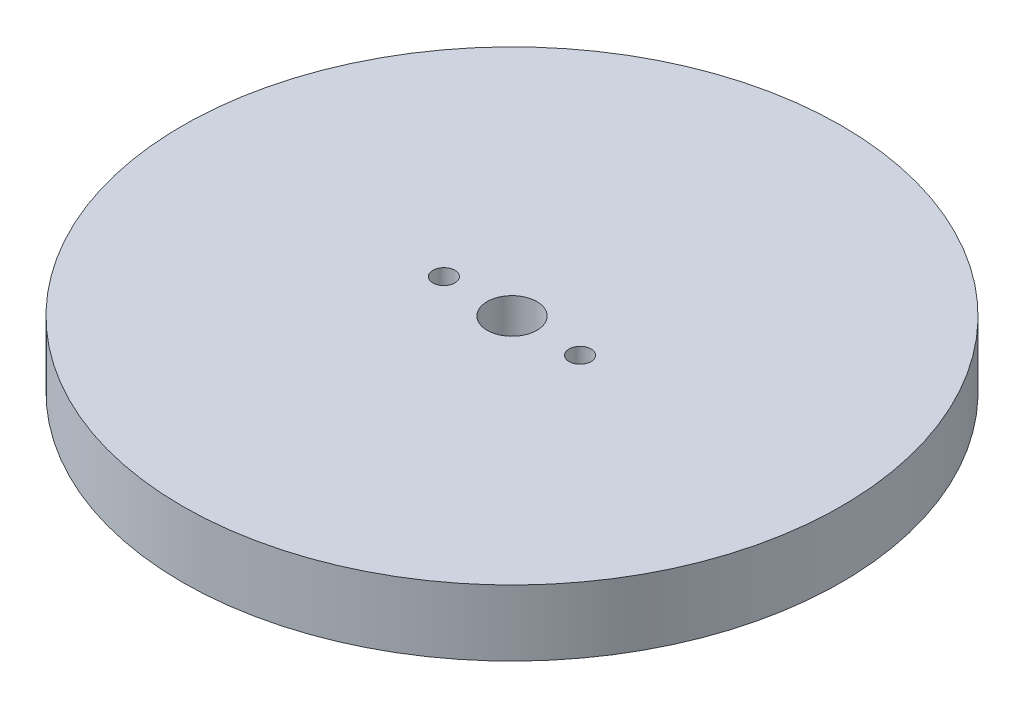
from build123d import *

# Parameters (mm, degrees)
SKETCH1_R           = 45
SKETCH1_R_2         = 3.4
SKETCH1_R_3         = 1.5
BOSS_EXTRUDE1_DEPTH = 9


with BuildPart() as part:
    # Sketch1 → Boss-Extrude1 (new body)
    with BuildSketch(Plane(origin=(0, 0, 0), x_dir=(1, 0, 0), z_dir=(0, 1, 0))):
        with Locations((-30.18350584, -19.145341983)):
            Circle(SKETCH1_R)
        with Locations((-30.18350584, -19.145341983)):
            Circle(SKETCH1_R_2, mode=Mode.SUBTRACT)
        with Locations((-39.48350584, -19.145341983)):
            Circle(SKETCH1_R_3, mode=Mode.SUBTRACT)
        with Locations((-20.88350584, -19.145341983)):
            Circle(SKETCH1_R_3, mode=Mode.SUBTRACT)
    extrude(amount=BOSS_EXTRUDE1_DEPTH)


solid = part.part
